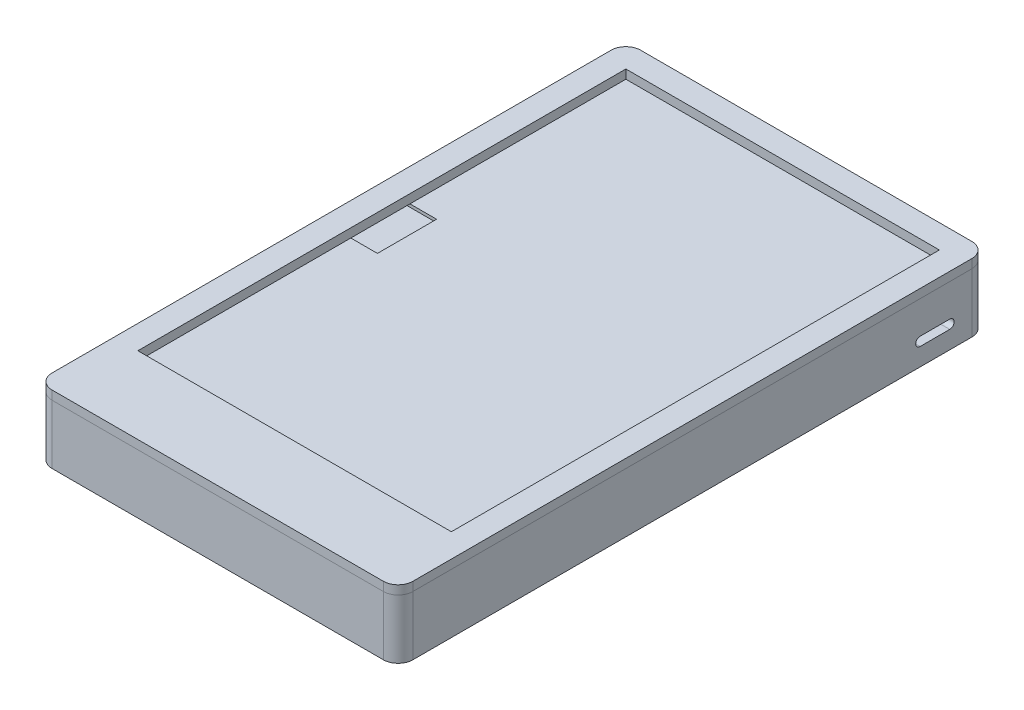
from build123d import *

# Parameters (mm, degrees)
SKETCH2_W                      = 112
SKETCH2_H                      = 171
BOSS_EXTRUDE1_DEPTH            = 2
SKETCH3_W                      = 112
SKETCH3_H                      = 171
BOSS_EXTRUDE2_DEPTH            = 20
BOSS_EXTRUDE3_DEPTH            = 3
SKETCH6_W                      = 59.3
SKETCH6_H                      = 25
BOSS_EXTRUDE4_DEPTH            = 2
SKETCH7_W                      = 112
SKETCH7_H                      = 18
CUT_EXTRUDE1_DEPTH             = 21
SKETCH8_W                      = 60
SKETCH8_H                      = 98
BOSS_EXTRUDE5_DEPTH            = 9
SKETCH9_W                      = 30
SKETCH9_H                      = 65
BOSS_EXTRUDE6_DEPTH            = 7
SKETCH9_W_2                    = 31
SKETCH9_H_2                    = 65.3
BOSS_EXTRUDE6_2_DEPTH          = 7
BOSS_EXTRUDE7_DEPTH            = 3
BOSS_EXTRUDE7_2_DEPTH          = 3
SKETCH10_W                     = 40.86076044
SKETCH10_H                     = 3
BOSS_EXTRUDE7_3_DEPTH          = 3
SKETCH11_W                     = 11
SKETCH11_H                     = 6
CUT_EXTRUDE2_DEPTH             = 13
SKETCH13_W                     = 112
SKETCH13_H                     = 3
BOSS_EXTRUDE8_DEPTH            = 13
BOSS_EXTRUDE10_DEPTH           = 3
BOSS_EXTRUDE11_START           = 10
BOSS_EXTRUDE11_DEPTH           = 3
SKETCH17_W                     = 11
SKETCH17_H                     = 6
CUT_EXTRUDE3_DEPTH             = 13
SKETCH18_W                     = 5
SKETCH18_H                     = 11
BOSS_EXTRUDE12_DEPTH           = 6
SKETCH19_W                     = 112
SKETCH19_H                     = 3
BOSS_EXTRUDE13_DEPTH           = 2
BOSS_EXTRUDE14_START           = 2
SKETCH20_W                     = 112
SKETCH20_H                     = 168
BOSS_EXTRUDE14_DEPTH           = 1
SKETCH21_W                     = 10
SKETCH21_H                     = 20
CUT_EXTRUDE4_DEPTH             = 1
SKETCH22_W                     = 112
SKETCH22_H                     = 171
SKETCH22_W_2                   = 106
SKETCH22_H_2                   = 165
BOSS_EXTRUDE15_DEPTH           = 3
SKETCH23_W                     = 112
SKETCH23_H                     = 3
BOSS_EXTRUDE16_DEPTH           = 17
SKETCH24_W                     = 112
SKETCH24_H                     = 171
BOSS_EXTRUDE17_DEPTH           = 2
SKETCH25_W                     = 92
SKETCH25_H                     = 8
CUT_EXTRUDE5_DEPTH             = 6
SKETCH26_W                     = 112
SKETCH26_H                     = 21
SKETCH26_W_2                   = 31
SKETCH26_H_2                   = 17
BOSS_EXTRUDE18_DEPTH           = 1
SKETCH27_W                     = 19.5
SKETCH27_H                     = 3
CUT_EXTRUDE6_DEPTH             = 3
SKETCH28_RX                    = 5.311188419
SKETCH28_RY                    = 2.709216475
CUT_EXTRUDE7_DEPTH             = 10
SKETCH29_RX                    = 5.311188419
SKETCH29_RY                    = 2.709216475
CUT_EXTRUDE8_DEPTH             = 2
SKETCH30_RX                    = 5.311188419
SKETCH30_RY                    = 2.709216475
CUT_EXTRUDE9_DEPTH             = 11.5
SKETCH31_RX                    = 5.311188419
SKETCH31_RY                    = 2.709216475
BOSS_EXTRUDE19_DEPTH           = 3
SKETCH32_W                     = 59.3
SKETCH32_H                     = 7
CUT_EXTRUDE10_DEPTH            = 3.5
SKETCH33_W                     = 13
SKETCH33_H                     = 4
CUT_EXTRUDE11_DEPTH            = 3
CUT_EXTRUDE13_DEPTH            = 22
CHAMFER1_SIZE                  = 3
SKETCH37_W                     = 1.5
SKETCH37_H                     = 4
CUT_EXTRUDE14_DEPTH            = 10
SKETCH38_W                     = 1.5
SKETCH38_H                     = 2
CUT_EXTRUDE15_DEPTH            = 3.5
SKETCH39_W                     = 3.5
SKETCH39_H                     = 1
CUT_EXTRUDE16_DEPTH            = 1.5
BOSS_EXTRUDE20_DEPTH           = 1
SKETCH41_R                     = 2
BOSS_EXTRUDE21_DEPTH           = 2
F_1_0MM_DOWEL_HOLE1_AT_2_COUNT = 2
F_1_0MM_DOWEL_HOLE1_AT_2_PITCH = 102.5
F_1_0MM_DOWEL_HOLE1_AT_3_COUNT = 2
F_1_0MM_DOWEL_HOLE1_AT_3_PITCH = 187
SKETCH59_R                     = 2
CUT_EXTRUDE17_DEPTH            = 2


with BuildPart() as part:
    # Sketch2 → Boss-Extrude1 (new body)
    with BuildSketch(Plane(origin=(0, 0, 0), x_dir=(1, 0, 0), z_dir=(0, 1, 0))):
        Rectangle(SKETCH2_W, SKETCH2_H)
    extrude(amount=BOSS_EXTRUDE1_DEPTH)


with BuildPart() as body_2:
    # Sketch3 → Boss-Extrude2 (new body)
    with BuildSketch(Plane(origin=(0, 2, 0), x_dir=(1, 0, 0), z_dir=(0, 1, 0))):
        with BuildLine():
            Line((61, -85.5), (61, 85.5))
            ThreePointArc((61, 85.5), (59.535533906, 89.035533906), (56, 90.5))
            Line((56, 90.5), (-56, 90.5))
            ThreePointArc((-56, 90.5), (-59.535533906, 89.035533906), (-61, 85.5))
            Line((-61, 85.5), (-61, -85.5))
            Line((-61, -85.5), (-61, -103.5))
            ThreePointArc((-61, -103.5), (-59.535533906, -107.035533906), (-56, -108.5))
            Line((-56, -108.5), (56, -108.5))
            ThreePointArc((56, -108.5), (59.535533906, -107.035533906), (61, -103.5))
            Line((61, -103.5), (61, -85.5))
        make_face()
        Rectangle(SKETCH3_W, SKETCH3_H, mode=Mode.SUBTRACT)
    extrude(amount=-BOSS_EXTRUDE2_DEPTH)

    # Sketch4 → Boss-Extrude3 (add)
    with BuildSketch(Plane.XZ.offset(18)):
        with BuildLine():
            Line((56, -90.5), (-56, -90.5))
            ThreePointArc((-56, -90.5), (-59.535533906, -89.035533906), (-61, -85.5))
            Line((-61, -85.5), (-61, 103.5))
            ThreePointArc((-61, 103.5), (-59.535533906, 107.035533906), (-56, 108.5))
            Line((-56, 108.5), (56, 108.5))
            ThreePointArc((56, 108.5), (59.535533906, 107.035533906), (61, 103.5))
            Line((61, 103.5), (61, -85.5))
            ThreePointArc((61, -85.5), (59.535533906, -89.035533906), (56, -90.5))
        make_face()
    extrude(amount=BOSS_EXTRUDE3_DEPTH)

    # Sketch7 → Cut-Extrude1 (cut)
    with BuildSketch(Plane(origin=(0, 0, 85.5), x_dir=(-1, 0, 0), z_dir=(0, 0, -1))):
        with Locations((0, -9)):
            Rectangle(SKETCH7_W, SKETCH7_H)
    extrude(amount=-CUT_EXTRUDE1_DEPTH, mode=Mode.SUBTRACT)


with BuildPart() as body_3:
    # Sketch6 → Boss-Extrude4 (new body)
    with BuildSketch(Plane(origin=(0, -18, 0), x_dir=(1, 0, 0), z_dir=(0, 1, 0))):
        with Locations((26.35, 73)):
            Rectangle(SKETCH6_W, SKETCH6_H)
    extrude(amount=BOSS_EXTRUDE4_DEPTH)


with BuildPart() as body_4:
    # Sketch8 → Boss-Extrude5 (new body)
    with BuildSketch(Plane(origin=(0, -18, 0), x_dir=(1, 0, 0), z_dir=(0, 1, 0))):
        with Locations((26, 6.5)):
            Rectangle(SKETCH8_W, SKETCH8_H)
    extrude(amount=BOSS_EXTRUDE5_DEPTH)


with BuildPart() as body_5:
    # Sketch9 → Boss-Extrude6 (new body)
    with BuildSketch(Plane(origin=(0, -18, 0), x_dir=(1, 0, 0), z_dir=(0, 1, 0))):
        with Locations((-41, 33)):
            Rectangle(SKETCH9_W, SKETCH9_H)
    extrude(amount=BOSS_EXTRUDE6_DEPTH)


with BuildPart() as body_6:
    # Sketch9 → Boss-Extrude6 2 (new body)
    with BuildSketch(Plane(origin=(0, -18, 0), x_dir=(1, 0, 0), z_dir=(0, 1, 0))):
        with Locations((-40.5, -37.15)):
            Rectangle(SKETCH9_W_2, SKETCH9_H_2)
    extrude(amount=BOSS_EXTRUDE6_2_DEPTH)


with BuildPart() as body_7:
    # Sketch10 → Boss-Extrude7 (new body)
    with BuildSketch(Plane(origin=(0, -18, 0), x_dir=(1, 0, 0), z_dir=(0, 1, 0))):
        Polygon((-10.5, -32.65), (-4.86076044, -32.65), (-4.86076044, 57), (56, 57), (56, 59), (-4.8, 59), (-4.8, 85.5), (-7.8, 85.5), (-7.8, -1), (-21.5, -1), (-21.5, 70), (-56, 70), (-56, 67), (-24.5, 67), (-24.5, -1), (-56, -1), (-56, -6), (-46, -6), (-46, -32.65), (-43, -32.65), (-43, -6), (-10.5, -6), align=None)
    extrude(amount=BOSS_EXTRUDE7_DEPTH)

    # Combine1: union body 2
    add(body_2.part)


with BuildPart() as body_8:
    # Sketch10 → Boss-Extrude7 2 (new body)
    with BuildSketch(Plane(origin=(0, -18, 0), x_dir=(1, 0, 0), z_dir=(0, 1, 0))):
        Polygon((-43, -74.3), (-10.5, -74.3), (-10.5, -47.65), (-4.86076044, -47.65), (-4.86076044, -77.3), (-46, -77.3), (-46, -47.65), (-43, -47.65), align=None)
    extrude(amount=BOSS_EXTRUDE7_2_DEPTH)


with BuildPart() as body_9:
    # Sketch10 → Boss-Extrude7 3 (new body)
    with BuildSketch(Plane(origin=(0, -18, 0), x_dir=(1, 0, 0), z_dir=(0, 1, 0))):
        with Locations((35.56961978, -45.5)):
            Rectangle(SKETCH10_W, SKETCH10_H)
    extrude(amount=BOSS_EXTRUDE7_3_DEPTH)


with BuildPart() as body_7_1:
    add(body_7.part)

    # Combine2: union body 8, body 9
    add(body_8.part)
    add(body_9.part)

    # Sketch11 → Cut-Extrude2 (cut)
    with BuildSketch(Plane(origin=(-56, 0, 0), x_dir=(0, 0, -1), z_dir=(1, 0, 0))):
        with Locations((75, -8)):
            Rectangle(SKETCH11_W, SKETCH11_H)
    extrude(amount=-CUT_EXTRUDE2_DEPTH, mode=Mode.SUBTRACT)


with BuildPart() as body_7_2:
    # Sketch13 → Boss-Extrude8 (new body)
    with BuildSketch(Plane(origin=(0, -18, 0), x_dir=(1, 0, 0), z_dir=(0, 1, 0))):
        with Locations((0, -84)):
            Rectangle(SKETCH13_W, SKETCH13_H)
    extrude(amount=BOSS_EXTRUDE8_DEPTH)

    # Combine3: union body 7
    add(body_7_1.part)


with BuildPart() as body_7_3:
    # Sketch15 → Boss-Extrude10 (new body)
    with BuildSketch(Plane(origin=(0, -5, 0), x_dir=(1, 0, 0), z_dir=(0, 1, 0))):
        Polygon((-56, -82.5), (-56, -74.5), (-53, -74.5), (-53, -79.5), (-48, -79.5), (-48, -82.5), align=None)
    boss_extrude10 = extrude(amount=-BOSS_EXTRUDE10_DEPTH)


with BuildPart() as body_7_2_1:
    add(body_7_2.part)

    # Mirror2: Boss-Extrude10 across plane
    add(boss_extrude10.mirror(Plane(origin=(0, 0, 0), x_dir=(0, 0, 1), z_dir=(1, 0, 0))))


with BuildPart() as body_7_3_1:
    add(body_7_3.part)

    # Combine7: union body 7 2
    add(body_7_2_1.part)


with BuildPart() as body_7_4:
    # Sketch16 → Boss-Extrude11 (new body)
    with BuildSketch(Plane(origin=(0, -18, 0), x_dir=(1, 0, 0), z_dir=(0, 1, 0)).offset(BOSS_EXTRUDE11_START)):
        Polygon((-56, 85.5), (-48, 85.5), (-48, 82.5), (-53, 82.5), (-53, 77.5), (-56, 77.5), align=None)
    boss_extrude11 = extrude(amount=BOSS_EXTRUDE11_DEPTH)


with BuildPart() as body_7_3_2:
    add(body_7_3_1.part)

    # Mirror4: Boss-Extrude11 across plane
    add(boss_extrude11.mirror(Plane(origin=(0, 0, 0), x_dir=(0, 0, 1), z_dir=(1, 0, 0))))

    # Sketch17 → Cut-Extrude3 (cut)
    with BuildSketch(Plane.XY.offset(-85.5)):
        with Locations((-34.5, -9)):
            Rectangle(SKETCH17_W, SKETCH17_H)
    extrude(amount=-CUT_EXTRUDE3_DEPTH, mode=Mode.SUBTRACT)

    add(body_7_4.part)  # Boss-Extrude12 merges body 7 4
    # Sketch18 → Boss-Extrude12 (add)
    with BuildSketch(Plane(origin=(0, -11, 0), x_dir=(1, 0, 0), z_dir=(0, 1, 0))):
        with Locations((-58.5, 75)):
            Rectangle(SKETCH18_W, SKETCH18_H)
    extrude(amount=BOSS_EXTRUDE12_DEPTH)

    # Sketch19 → Boss-Extrude13 (add)
    with BuildSketch(Plane(origin=(0, -5, 0), x_dir=(1, 0, 0), z_dir=(0, 1, 0))):
        with Locations((0, -84)):
            Rectangle(SKETCH19_W, SKETCH19_H)
    extrude(amount=BOSS_EXTRUDE13_DEPTH)

    # Sketch22 → Boss-Extrude15 (add)
    with BuildSketch(Plane(origin=(0, 2, 0), x_dir=(1, 0, 0), z_dir=(0, 1, 0))):
        Rectangle(SKETCH22_W, SKETCH22_H)
        Rectangle(SKETCH22_W_2, SKETCH22_H_2, mode=Mode.SUBTRACT)
    extrude(amount=-BOSS_EXTRUDE15_DEPTH)


with BuildPart() as body_7_5:
    # Sketch20 → Boss-Extrude14 (new body)
    with BuildSketch(Plane(origin=(0, -5, 0), x_dir=(1, 0, 0), z_dir=(0, 1, 0)).offset(BOSS_EXTRUDE14_START)):
        with Locations((0, 1.5)):
            Rectangle(SKETCH20_W, SKETCH20_H)
    extrude(amount=-BOSS_EXTRUDE14_DEPTH)

    # Sketch21 → Cut-Extrude4 (cut)
    with BuildSketch(Plane(origin=(0, -4, 0), x_dir=(-1, 0, 0), z_dir=(0, -1, 0))):
        with Locations((51, 1.5)):
            Rectangle(SKETCH21_W, SKETCH21_H)
    extrude(amount=-CUT_EXTRUDE4_DEPTH, mode=Mode.SUBTRACT)


with BuildPart() as body_8_2:
    # Split1: the piece on the far side of the plane
    add(body_7_3_2.part)
    split(bisect_by=Plane(origin=(0, -1, 0), x_dir=(0, 0, -1), z_dir=(0, -1, 0)), keep=Keep.BOTTOM)

    # Sketch26 → Boss-Extrude18 (add)
    with BuildSketch(Plane(origin=(0, 0, 0), x_dir=(-1, 0, 0), z_dir=(0, -1, 0))):
        with Locations((0, -96)):
            Rectangle(SKETCH26_W, SKETCH26_H)
        with Locations((0, -97.5)):
            Rectangle(SKETCH26_W_2, SKETCH26_H_2, mode=Mode.SUBTRACT)
        with Locations((-34.6, -97.5)):
            Rectangle(SKETCH26_W_2, SKETCH26_H_2, mode=Mode.SUBTRACT)
        with Locations((35.4, -97.5)):
            Rectangle(SKETCH26_W_2, SKETCH26_H_2, mode=Mode.SUBTRACT)
    extrude(amount=BOSS_EXTRUDE18_DEPTH)

    # Sketch59 → Cut-Extrude17 (cut)
    with BuildSketch(Plane(origin=(0, 1, 0), x_dir=(1, 0, 0), z_dir=(0, 1, 0))):
        with Locations(Location((58.5, 0, 0), (0, 0, 270))):
            Circle(SKETCH59_R)
        with Locations(Location((58.5, 84.5, 0), (0, 0, 270))):
            Circle(SKETCH59_R)
        with Locations(Location((-58.5, 84.5, 0), (0, 0, 90))):
            Circle(SKETCH59_R)
        with Locations(Location((-58.5, 0, 0), (0, 0, 90))):
            Circle(SKETCH59_R)
        with Locations(Location((-58.5, -102.5, 0), (0, 0, 90))):
            Circle(SKETCH59_R)
        with Locations(Location((58.5, -102.5, 0), (0, 0, 270))):
            Circle(SKETCH59_R)
    extrude(amount=-CUT_EXTRUDE17_DEPTH, mode=Mode.SUBTRACT)


with BuildPart() as body_7_3_3:
    add(body_7_3_2.part)

    # Split1
    split(bisect_by=Plane(origin=(0, -1, 0), x_dir=(0, 0, -1), z_dir=(0, -1, 0)), keep=Keep.TOP)

    # Sketch23 → Boss-Extrude16 (add)
    with BuildSketch(Plane(origin=(0, -18, 0), x_dir=(1, 0, 0), z_dir=(0, 1, 0))):
        with Locations((0, -87)):
            Rectangle(SKETCH23_W, SKETCH23_H)
    extrude(amount=BOSS_EXTRUDE16_DEPTH)

    # Sketch25 → Cut-Extrude5 (cut)
    with BuildSketch(Plane.XY.offset(88.5)):
        with Locations((0, -14)):
            Rectangle(SKETCH25_W, SKETCH25_H)
    extrude(amount=-CUT_EXTRUDE5_DEPTH, mode=Mode.SUBTRACT)

    # Sketch27 → Cut-Extrude6 (cut)
    with BuildSketch(Plane(origin=(0, -15, 0), x_dir=(1, 0, 0), z_dir=(0, 1, 0))):
        with Locations((-38.25, 68.5)):
            Rectangle(SKETCH27_W, SKETCH27_H)
    extrude(amount=-CUT_EXTRUDE6_DEPTH, mode=Mode.SUBTRACT)

    # Sketch28 → Cut-Extrude7 (cut)
    with BuildSketch(Plane(origin=(-56, 0, 0), x_dir=(0, 0, -1), z_dir=(1, 0, 0))):
        with Locations(Location((10.916600022, -15.2), (0, 0, 180))):
            Ellipse(SKETCH28_RX, SKETCH28_RY)
    extrude(amount=-CUT_EXTRUDE7_DEPTH, mode=Mode.SUBTRACT)

    # Sketch29 → Cut-Extrude8 (cut)
    with BuildSketch(Plane(origin=(-56, 0, 0), x_dir=(0, 0, -1), z_dir=(1, 0, 0))):
        with Locations(Location((23.436540933, -15.2), (0, 0, 180))):
            Ellipse(SKETCH29_RX, SKETCH29_RY)
        with BuildLine():
            Line((46.102671125, -18), (58.351236645, -18))
            add(Edge.make_bspline(
                [(58.351236645, -18), (72.098039695, -11.035268503), (53.408654012, -11.035268503), (34.719268328, -11.035268503), (46.102671125, -18)],
                knots=[2.290722982, 2.290722982, 2.290722982, 4.598847215, 4.598847215, 6.906971447, 6.906971447, 6.906971447], degree=2, weights=[1, 0.404776328, 1, 0.404776328, 1]))
        make_face()
    extrude(amount=-CUT_EXTRUDE8_DEPTH, mode=Mode.SUBTRACT)

    # Sketch30 → Cut-Extrude9 (cut)
    with BuildSketch(Plane(origin=(-58, 0, 0), x_dir=(0, 0, -1), z_dir=(1, 0, 0))):
        with Locations(Location((23.436540933, -15.2), (0, 0, 180))):
            Ellipse(SKETCH30_RX, SKETCH30_RY)
    extrude(amount=-CUT_EXTRUDE9_DEPTH, mode=Mode.SUBTRACT)

    # Sketch31 → Boss-Extrude19 (add)
    with BuildSketch(Plane.ZY.offset(61)):
        with Locations((-10.916600022, -15.2)):
            Ellipse(SKETCH31_RX, SKETCH31_RY)
    extrude(amount=-BOSS_EXTRUDE19_DEPTH)

    # Sketch32 → Cut-Extrude10 (cut)
    with BuildSketch(Plane.XY.offset(-85.5)):
        with Locations((26.35, -14.5)):
            Rectangle(SKETCH32_W, SKETCH32_H)
    extrude(amount=-CUT_EXTRUDE10_DEPTH, mode=Mode.SUBTRACT)

    # Sketch33 → Cut-Extrude11 (cut)
    with BuildSketch(Plane.XY.offset(-89)):
        with Locations((1.7, -14)):
            Rectangle(SKETCH33_W, SKETCH33_H)
    extrude(amount=-CUT_EXTRUDE11_DEPTH, mode=Mode.SUBTRACT)

    # Sketch35 → Cut-Extrude13 (cut)
    with BuildSketch(Plane.ZY.offset(-56)):
        with BuildLine():
            Line((-78, -12), (-68, -12))
            ThreePointArc((-68, -12), (-66.5, -13.5), (-68, -15))
            Line((-68, -15), (-78, -15))
            ThreePointArc((-78, -15), (-79.5, -13.5), (-78, -12))
        make_face()
    extrude(amount=-CUT_EXTRUDE13_DEPTH, mode=Mode.SUBTRACT)

    # Chamfer1
    chamfer1_edges = [body_7_3_3.edges().sort_by_distance(p)[0] for p in [
        (56, -8, 78.5),
        (52, -8, 82.5),
        (-56, -8, 78.5),
        (-52, -8, 82.5),
        (-52, -8, -85.5),
        (-56, -8, -81.5),
        (56, -8, -81.5),
        (52, -8, -85.5),
    ]]
    chamfer(chamfer1_edges, length=CHAMFER1_SIZE - 0.0001)  # a hair under: the kernel refuses the full size

    # Sketch37 → Cut-Extrude14 (cut)
    with BuildSketch(Plane(origin=(0, 0, -89), x_dir=(-1, 0, 0), z_dir=(0, 0, -1))):
        with Locations((4.05, -14)):
            Rectangle(SKETCH37_W, SKETCH37_H)
    extrude(amount=-CUT_EXTRUDE14_DEPTH, mode=Mode.SUBTRACT)

    # Sketch38 → Cut-Extrude15 (cut)
    with BuildSketch(Plane.XY.offset(-85.5)):
        with Locations((-4.05, -17)):
            Rectangle(SKETCH38_W, SKETCH38_H)
    extrude(amount=-CUT_EXTRUDE15_DEPTH, mode=Mode.SUBTRACT)

    # Sketch39 → Cut-Extrude16 (cut)
    with BuildSketch(Plane(origin=(-3.3, 0, 0), x_dir=(0, 0, -1), z_dir=(1, 0, 0))):
        with Locations((87.25, -11.5)):
            Rectangle(SKETCH39_W, SKETCH39_H)
    extrude(amount=-CUT_EXTRUDE16_DEPTH, mode=Mode.SUBTRACT)

    # Sketch40 → Boss-Extrude20 (add)
    with BuildSketch(Plane(origin=(0, -5, 0), x_dir=(1, 0, 0), z_dir=(0, 1, 0))):
        Polygon((-56, -82.5), (-48, -82.5), (-48, -79.5), (-53, -79.5), (-53, -74.5), (-56, -74.5), align=None)
        Polygon((48, -82.5), (56, -82.5), (56, -74.5), (53, -74.5), (53, -79.5), (48, -79.5), align=None)
        Polygon((56, 77.5), (56, 85.5), (48, 85.5), (48, 82.5), (53, 82.5), (53, 77.5), align=None)
        Polygon((-56, 85.5), (-56, 77.5), (-53, 77.5), (-53, 82.5), (-48, 82.5), (-48, 85.5), align=None)
    extrude(amount=BOSS_EXTRUDE20_DEPTH)

    # Sketch41 → Boss-Extrude21 (add)
    with BuildSketch(Plane(origin=(0, -1, 0), x_dir=(1, 0, 0), z_dir=(0, 1, 0))):
        with Locations(Location((-58.5, -102.5, 0), (0, 0, 90))):
            Circle(SKETCH41_R)
        with Locations(Location((-58.5, 84.5, 0), (0, 0, 90))):
            Circle(SKETCH41_R)
        with Locations(Location((-58.5, 0, 0), (0, 0, 90))):
            Circle(SKETCH41_R)
    boss_extrude21 = extrude(amount=BOSS_EXTRUDE21_DEPTH)

    # Sketch57 → Ø1.0mm Dowel Hole1 (revolve, cut)
    with BuildSketch(Plane(origin=(-58.5, 1, 102.5), x_dir=(0, 0, 1), z_dir=(1, 0, 0))):
        Polygon((0, 0), (0, 3.30043031), (0.5, 3), (0.5, 0), align=None)
    f_1_0mm_dowel_hole1 = revolve(axis=Axis((-58.5, 7.35, 102.5), (0, -1, 0)), mode=Mode.SUBTRACT)

    # Ø1.0mm Dowel Hole1 at 2: Ø1.0mm Dowel Hole1 ×2
    with Locations(*[(0, 0, -i * F_1_0MM_DOWEL_HOLE1_AT_2_PITCH) for i in range(1, F_1_0MM_DOWEL_HOLE1_AT_2_COUNT)]):
        add(f_1_0mm_dowel_hole1, mode=Mode.SUBTRACT)

    # Ø1.0mm Dowel Hole1 at 3: Ø1.0mm Dowel Hole1 ×2
    with Locations(*[(0, 0, -i * F_1_0MM_DOWEL_HOLE1_AT_3_PITCH) for i in range(1, F_1_0MM_DOWEL_HOLE1_AT_3_COUNT)]):
        add(f_1_0mm_dowel_hole1, mode=Mode.SUBTRACT)

    # Mirror5: Boss-Extrude21, Ø1.0mm Dowel Hole1 across plane
    add(boss_extrude21.mirror(Plane(origin=(0, 0, 0), x_dir=(0, 0, 1), z_dir=(1, 0, 0))))
    add(f_1_0mm_dowel_hole1.mirror(Plane(origin=(0, 0, 0), x_dir=(0, 0, 1), z_dir=(1, 0, 0))), mode=Mode.SUBTRACT)

    # Mirror5 copy 1 sketch → Mirror5 copy 1 (revolve, cut)
    with BuildSketch(Plane(origin=(58.5, 1, 0), x_dir=(0, 0, 1), z_dir=(-1, 0, 0))):
        Polygon((0, 0), (0, -3.30043031), (0.5, -3), (0.5, 0), align=None)
    revolve(axis=Axis((58.5, 7.35, 0), (0, 1, 0)), mode=Mode.SUBTRACT)

    # Mirror5 copy 2 sketch → Mirror5 copy 2 (revolve, cut)
    with BuildSketch(Plane(origin=(58.5, 1, -84.5), x_dir=(0, 0, 1), z_dir=(-1, 0, 0))):
        Polygon((0, 0), (0, -3.30043031), (0.5, -3), (0.5, 0), align=None)
    revolve(axis=Axis((58.5, 7.35, -84.5), (0, 1, 0)), mode=Mode.SUBTRACT)


with BuildPart() as body_8_3:
    # Sketch24 → Boss-Extrude17 (new body)
    with BuildSketch(Plane(origin=(0, -4, 0), x_dir=(-1, 0, 0), z_dir=(0, -1, 0))):
        Rectangle(SKETCH24_W, SKETCH24_H)
    extrude(amount=BOSS_EXTRUDE17_DEPTH)


solid = Compound([body_3.part, body_4.part, body_5.part, body_6.part, body_7_5.part, body_8_2.part, body_7_3_3.part, body_8_3.part])
